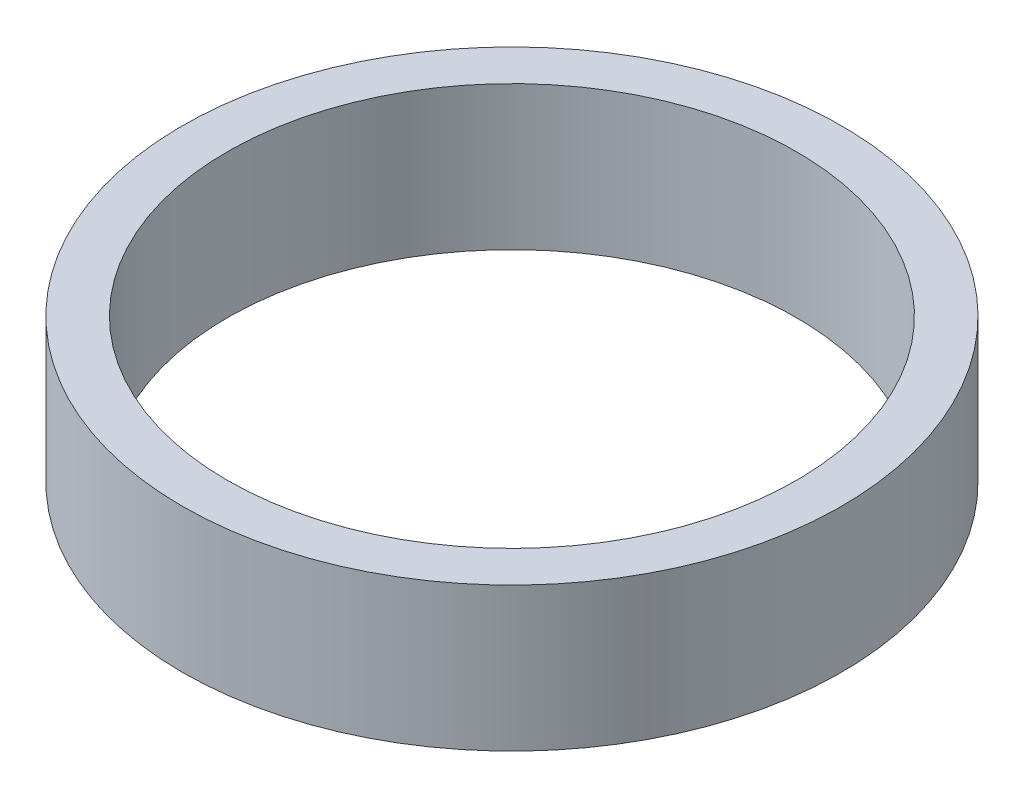
from build123d import *

# Parameters (mm, degrees)
SKETCH1_R           = 55
BOSS_EXTRUDE1_DEPTH = 24
SKETCH2_R           = 47.5
CUT_EXTRUDE1_DEPTH  = 82.4002457


with BuildPart() as part:
    # Sketch1 → Boss-Extrude1 (new body)
    with BuildSketch(Plane(origin=(0, 0, 0), x_dir=(1, 0, 0), z_dir=(0, 1, 0))):
        Circle(SKETCH1_R)
    extrude(amount=BOSS_EXTRUDE1_DEPTH)

    # Sketch2 → Cut-Extrude1 (cut, through all)
    with BuildSketch(Plane(origin=(0, 0, 0), x_dir=(1, 0, 0), z_dir=(0, 1, 0))):
        Circle(SKETCH2_R)
    extrude(amount=CUT_EXTRUDE1_DEPTH, mode=Mode.SUBTRACT)


solid = part.part
